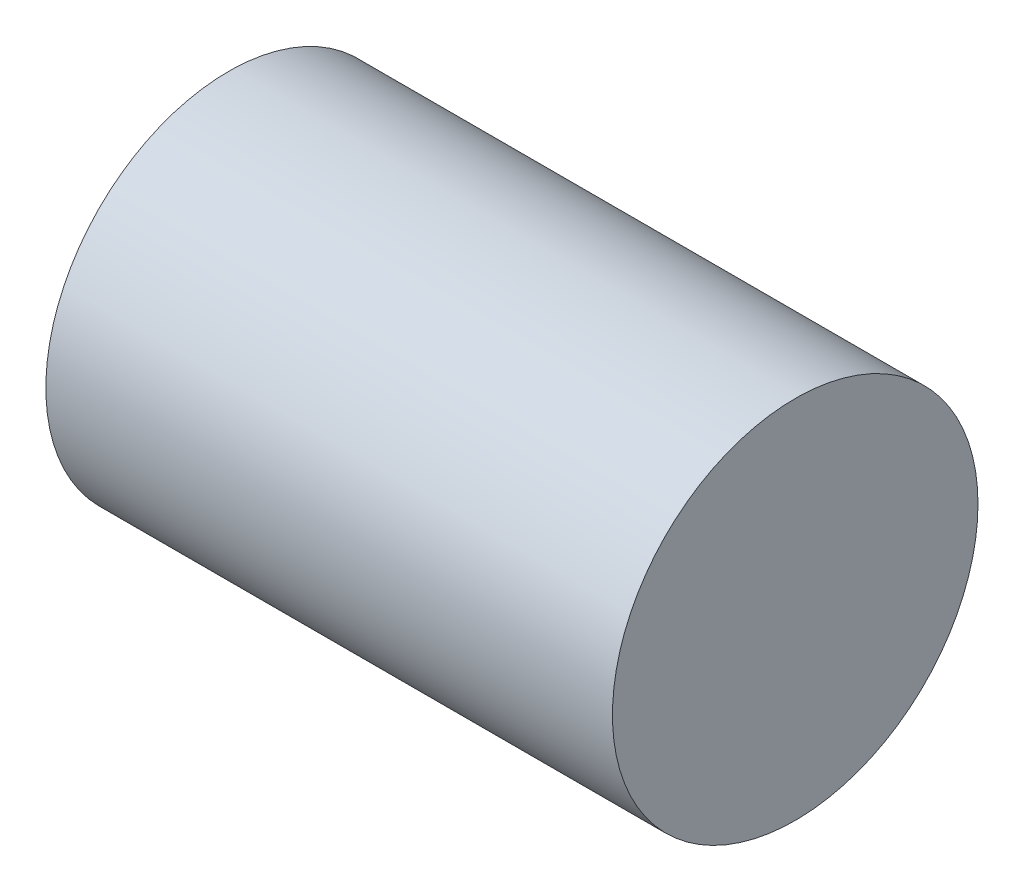
from build123d import *

# Parameters (mm, degrees)
SKETCH1_R           = 76.2
BOSS_EXTRUDE1_DEPTH = 236.22


with BuildPart() as part:
    # Sketch1 → Boss-Extrude1 (new body)
    with BuildSketch(Plane(origin=(0, 0, 0), x_dir=(0, 0, -1), z_dir=(1, 0, 0))):
        Circle(SKETCH1_R)
    extrude(amount=BOSS_EXTRUDE1_DEPTH)


solid = part.part
